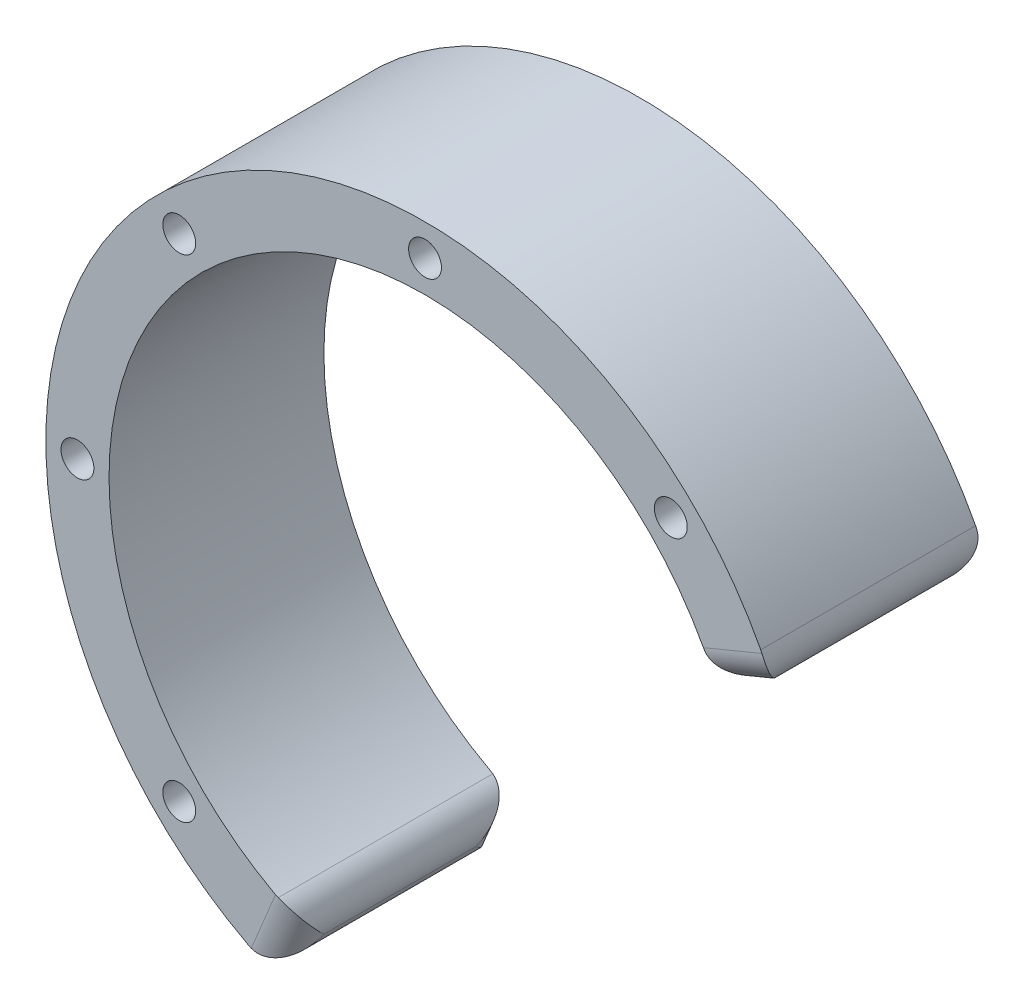
from build123d import *

# Parameters (mm, degrees)
SKETCH_2_R          = 60
SKETCH_2_R_2        = 2.6
SKETCH_2_R_3        = 50
EXTRUDE_1_DEPTH     = 34
CUT_EXTRUDE_START   = -34
SKETCH_3_R          = 2.6
CUT_EXTRUDE_1_DEPTH = 34
FILLET_1_R          = 5


with BuildPart() as part:
    # 草图2 → 凸台-拉伸1 (new body)
    with BuildSketch(Plane.XY):
        Circle(SKETCH_2_R)
        with Locations((0, 55)):
            Circle(SKETCH_2_R_2, mode=Mode.SUBTRACT)
        with Locations((38.890872965, 38.890872965)):
            Circle(SKETCH_2_R_2, mode=Mode.SUBTRACT)
        with Locations((55, 0)):
            Circle(SKETCH_2_R_2, mode=Mode.SUBTRACT)
        with Locations((38.890872965, -38.890872965)):
            Circle(SKETCH_2_R_2, mode=Mode.SUBTRACT)
        with Locations((0, -55)):
            Circle(SKETCH_2_R_2, mode=Mode.SUBTRACT)
        with Locations((-38.890872965, -38.890872965)):
            Circle(SKETCH_2_R_2, mode=Mode.SUBTRACT)
        with Locations((-55, 0)):
            Circle(SKETCH_2_R_2, mode=Mode.SUBTRACT)
        with Locations((-38.890872965, 38.890872965)):
            Circle(SKETCH_2_R_2, mode=Mode.SUBTRACT)
        Circle(SKETCH_2_R_3, mode=Mode.SUBTRACT)
    extrude(amount=EXTRUDE_1_DEPTH)

    # 草图3 → 切除-拉伸1 (cut)
    with BuildSketch(Plane.XY.offset(34).offset(CUT_EXTRUDE_START)):
        with BuildLine():
            Line((55.432771951, 22.961005942), (46.193976626, 19.134171618))
            ThreePointArc((46.193976626, 19.134171618), (49.03926402, 9.754516101), (50, 0))
            ThreePointArc((50, 0), (27.778511651, -41.573480615), (-19.134171618, -46.193976626))
            Line((-19.134171618, -46.193976626), (-22.961005942, -55.432771951))
            ThreePointArc((-22.961005942, -55.432771951), (33.334213981, -49.888176738), (60, 0))
            ThreePointArc((60, 0), (58.847116824, 11.705419321), (55.432771951, 22.961005942))
        make_face()
        with Locations((0, -55)):
            Circle(SKETCH_3_R, mode=Mode.SUBTRACT)
        with Locations((38.890872965, -38.890872965)):
            Circle(SKETCH_3_R, mode=Mode.SUBTRACT)
        with Locations((55, 0)):
            Circle(SKETCH_3_R, mode=Mode.SUBTRACT)
    extrude(amount=CUT_EXTRUDE_1_DEPTH, mode=Mode.SUBTRACT)

    # 圆角1
    fillet_1_edges = [part.edges().sort_by_distance(p)[0] for p in [
        (-19.134171618, -46.193976626, 17),
        (50.813374288, 21.04758878, 34),
        (46.193976626, 19.134171618, 17),
        (55.432771951, 22.961005942, 17),
        (-21.04758878, -50.813374288, 0),
        (-22.961005942, -55.432771951, 17),
        (50.813374288, 21.04758878, 0),
        (-21.04758878, -50.813374288, 34),
    ]]
    fillet(fillet_1_edges, radius=FILLET_1_R - 0.0001)  # a hair under: the kernel refuses the full size


solid = part.part
